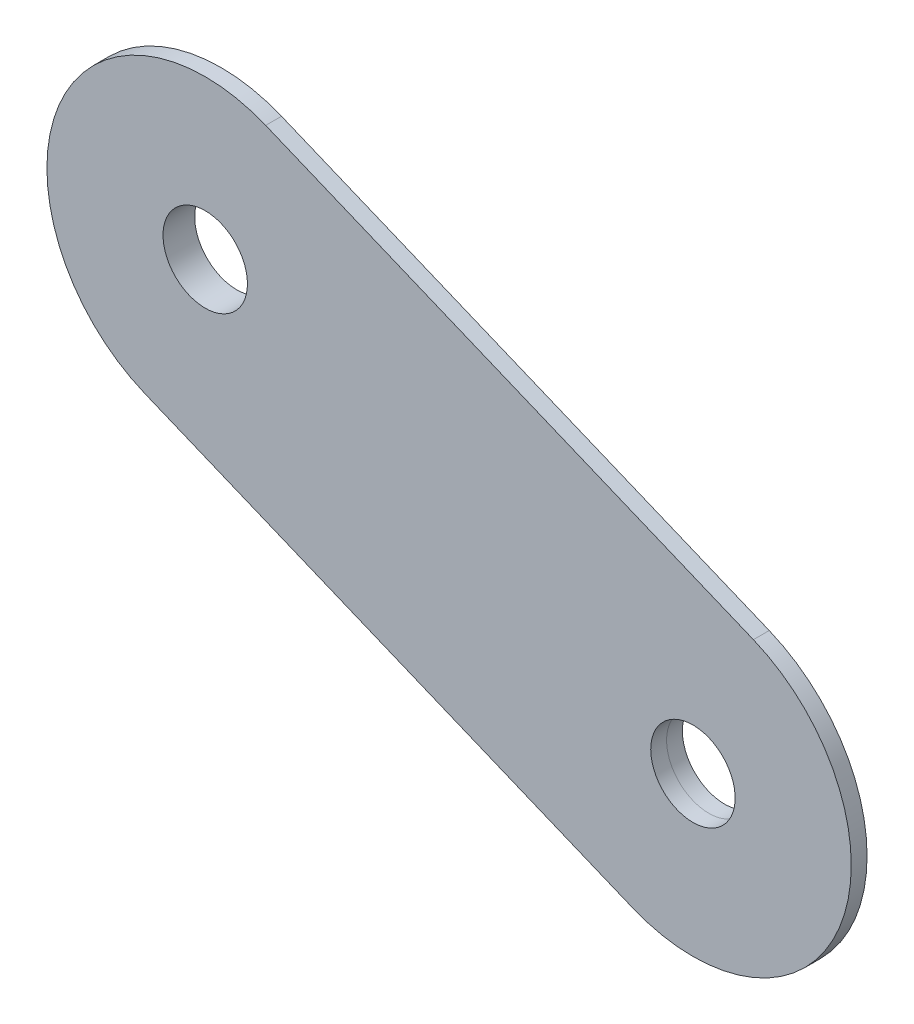
from build123d import *

# Parameters (mm, degrees)
SKETCH1_R             = 7.5
SKETCH1_R_2           = 4
BOSS_EXTRUDE1_DEPTH   = 1.5
BOSS_EXTRUDE1_2_DEPTH = 1.5
SKETCH2_R             = 4
BOSS_EXTRUDE2_DEPTH   = 1.5


with BuildPart() as part:
    # Sketch1 → Boss-Extrude1 (new body)
    with BuildSketch(Plane.XY):
        Circle(SKETCH1_R)
        Circle(SKETCH1_R_2, mode=Mode.SUBTRACT)
    extrude(amount=BOSS_EXTRUDE1_DEPTH)

    # Sketch2 → Boss-Extrude2 (add)
    with BuildSketch(Plane.XY.offset(1.5)):
        with BuildLine():
            Line((5.72773978, 13.863368891), (51.938969417, -5.229097043))
            ThreePointArc((51.938969417, -5.229097043), (60.074598528, -24.820205715), (40.483489857, -32.955834825))
            Line((40.483489857, -32.955834825), (-5.72773978, -13.863368891))
            ThreePointArc((-5.72773978, -13.863368891), (-13.863368891, 5.72773978), (5.72773978, 13.863368891))
        make_face()
        Circle(SKETCH2_R, mode=Mode.SUBTRACT)
        with Locations((46.211229637, -19.092465934)):
            Circle(SKETCH2_R, mode=Mode.SUBTRACT)
    extrude(amount=BOSS_EXTRUDE2_DEPTH)


with BuildPart() as body_2:
    # Sketch1 → Boss-Extrude1 2 (new body)
    with BuildSketch(Plane.XY):
        with Locations((46.211229637, -19.092465934)):
            Circle(SKETCH1_R)
        with Locations((46.211229637, -19.092465934)):
            Circle(SKETCH1_R_2, mode=Mode.SUBTRACT)
    extrude(amount=BOSS_EXTRUDE1_2_DEPTH)


solid = Compound([part.part, body_2.part])
